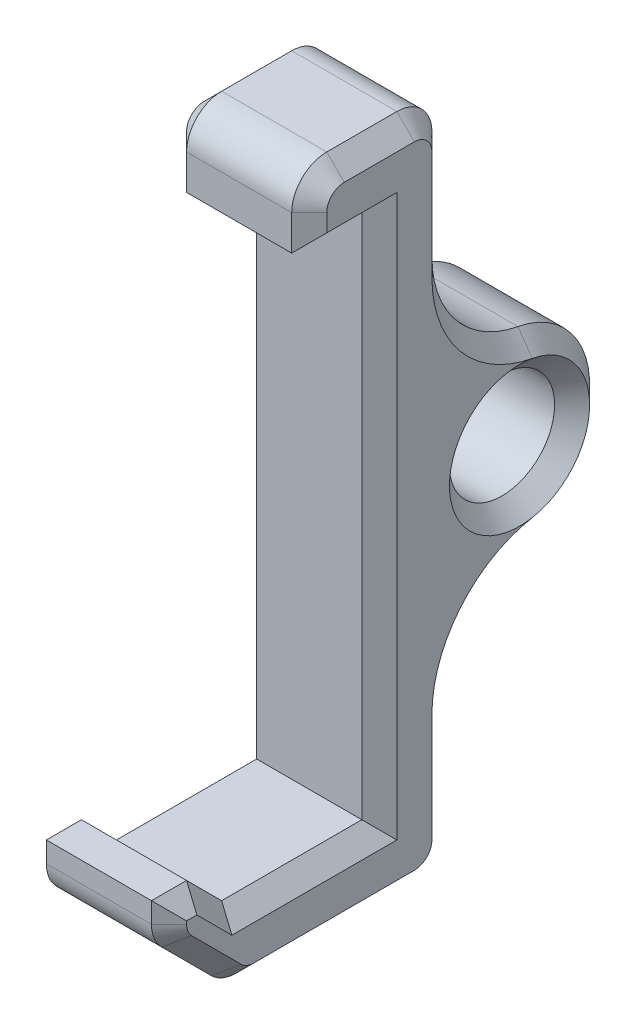
from build123d import *

# Parameters (mm, degrees)
BOSS_EXTRUDE1_DEPTH      = 2
BOSS_EXTRUDE1_DEPTH_BACK = 2
SKETCH2_R                = 1.5
FILLET1_R                = 3
FILLET2_R                = 1
CHAMFER1_SIZE            = 0.5


with BuildPart() as part:
    # Sketch2 → Boss-Extrude1 (new, two sides: drawn at the far end of the back side and taken through both)
    with BuildSketch(Plane(origin=(0, 0, 0), x_dir=(0, 0, -1), z_dir=(1, 0, 0)).offset(-BOSS_EXTRUDE1_DEPTH_BACK)):
        with BuildLine():
            ThreePointArc((4, 2.5), (6.5, 0), (4, -2.5))
            Line((4, -2.5), (2, -2.5))
            Line((2, -2.5), (2, -9.5))
            Line((2, -9.5), (-4, -9.5))
            Line((-4, -9.5), (-6, -7.5))
            Line((-6, -7.5), (-6, -6.5))
            Line((-6, -6.5), (-5, -6.5))
            Line((-5, -6.5), (-4, -7.5))
            Line((-4, -7.5), (0, -7.5))
            Line((0, -7.5), (0, 7.5))
            Line((0, 7.5), (-2, 7.5))
            Line((-2, 7.5), (-2, 9.5))
            Line((-2, 9.5), (2, 9.5))
            Line((2, 9.5), (2, 2.5))
            Line((2, 2.5), (4, 2.5))
        make_face()
        with Locations((4, 0)):
            Circle(SKETCH2_R, mode=Mode.SUBTRACT)
    extrude(amount=BOSS_EXTRUDE1_DEPTH + BOSS_EXTRUDE1_DEPTH_BACK)

    # Fillet1
    fillet1_edges = [part.edges().sort_by_distance(p)[0] for p in [
        (0, 2.5, -2),
        (0, -2.5, -2),
    ]]
    fillet(fillet1_edges, radius=FILLET1_R)

    # Fillet2
    fillet2_edges = [part.edges().sort_by_distance(p)[0] for p in [
        (0, -9.5, -2),
        (0, -9.5, 4),
        (0, -7.5, 6),
        (0, 9.5, 2),
        (0, 9.5, -2),
    ]]
    fillet(fillet2_edges, radius=FILLET2_R)

    # Chamfer1
    chamfer1_edges = [part.edges().sort_by_distance(p)[0] for p in [
        (2, -8.5, 5),
        (2, -9.5, 1.292893219),
        (2, -6.954163457, -2),
        (2, 9.207106781, -1.707106781),
        (2, -9.207106781, -1.707106781),
        (2, -9.423879533, 3.96846987),
        (2, -7.46846987, 5.923879533),
        (2, 9.207106781, 1.707106781),
        (-2, 8, 2),
        (-2, -6.954163457, -2),
        (-2, -9.5, 1.292893219),
        (-2, -8.5, 5),
        (-2, 9.207106781, -1.707106781),
        (-2, -9.207106781, -1.707106781),
        (-2, -9.423879533, 3.96846987),
        (-2, -7.46846987, 5.923879533),
        (-2, 9.207106781, 1.707106781),
        (-2, 7.5, 1),
        (-2, 0, 0),
        (-2, -7.5, 2),
        (2, 0, -2.5),
        (2, 7.5, 1),
        (-2, -7, 4.5),
        (2, 0, 0),
        (2, -7.5, 2),
        (2, -7, 4.5),
        (2, -6.5, 5.5),
        (2, -6.792893219, 6),
        (-2, -6.5, 5.5),
        (-2, -6.792893219, 6),
        (-2, 0, -2.5),
        (2, 0, -6.5),
        (-2, 0, -6.5),
        (2, 6.954163457, -2),
        (-2, 6.954163457, -2),
        (2, 3.489495707, -2.693902257),
        (-2, 3.489545225, -2.693861055),
        (2, -3.489545225, -2.693861055),
        (-2, -3.489545225, -2.693861055),
        (2, 9.5, 0),
        (-2, 9.5, 0),
        (2, 8, 2),
    ]]
    chamfer(chamfer1_edges, length=CHAMFER1_SIZE - 0.0001)  # a hair under: the kernel refuses the full size


solid = part.part
